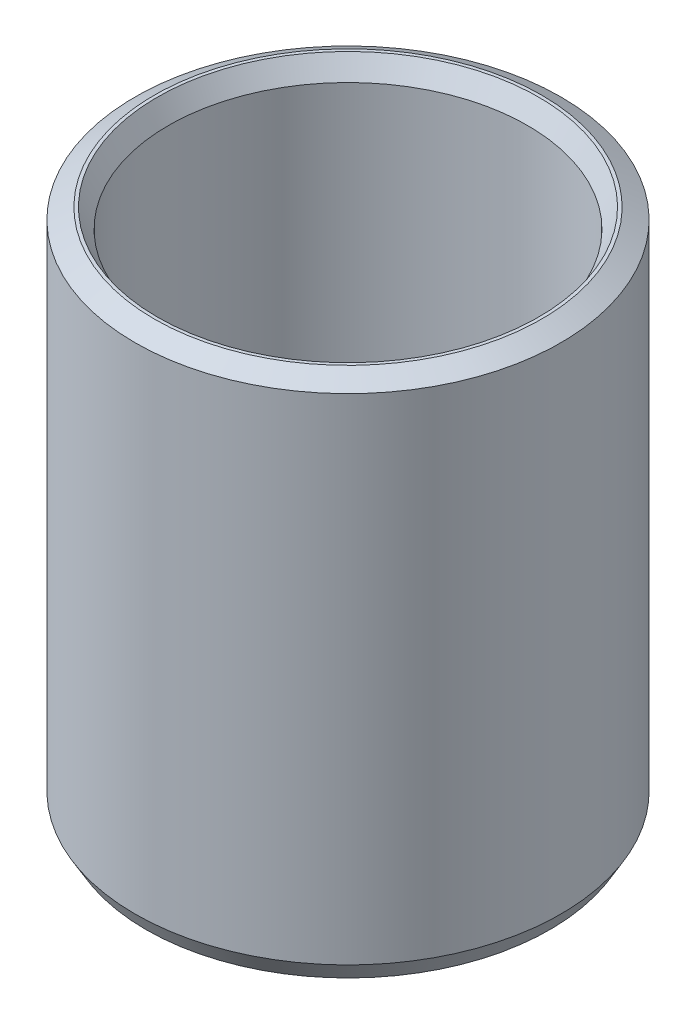
from build123d import *
from OCP.BRepFilletAPI import BRepFilletAPI_MakeChamfer

# Parameters (mm, degrees)
SKETCH1_R           = 37.5
BOSS_EXTRUDE1_DEPTH = 92.440721983
SKETCH2_R           = 31.630293139
CUT_EXTRUDE1_DEPTH  = 107.572919078
CHAMFER1_SIZE       = 1.940517333
CHAMFER1_SIZE2      = 3.361074614


with BuildPart() as part:
    # Sketch1 → Boss-Extrude1 (new body)
    with BuildSketch(Plane(origin=(0, 0, 0), x_dir=(1, 0, 0), z_dir=(0, 1, 0))):
        Circle(SKETCH1_R)
    extrude(amount=BOSS_EXTRUDE1_DEPTH)

    # Sketch2 → Cut-Extrude1 (cut, through all)
    with BuildSketch(Plane(origin=(0, 0, 0), x_dir=(1, 0, 0), z_dir=(0, 1, 0))):
        Circle(SKETCH2_R)
    extrude(amount=CUT_EXTRUDE1_DEPTH, mode=Mode.SUBTRACT)

    # Chamfer1: one chamfer whose edges measure the first distance from different faces: ONE call of the kernel's chamfer builder (chamfer() names one face for all edges)
    chamfer1_edges_1 = [part.edges().sort_by_distance(p)[0] for p in [
        (-31.630293139, 92.440721983, 0),
    ]]
    chamfer1_side_1 = [part.faces().sort_by_distance(p)[0] for p in [
        (-36.439339828, 92.440721983, 0),
    ]]
    chamfer1_edges_2 = [part.edges().sort_by_distance(p)[0] for p in [
        (-31.630293139, 0, 0),
    ]]
    chamfer1_side_2 = [part.faces().sort_by_distance(p)[0] for p in [
        (-31.630293139, 46.220360992, 0),
    ]]
    chamfer1_edges_3 = [part.edges().sort_by_distance(p)[0] for p in [
        (-37.5, 0, 0),
    ]]
    chamfer1_side_3 = [part.faces().sort_by_distance(p)[0] for p in [
        (-36.439339828, 0, 0),
    ]]
    chamfer1_edges_4 = [part.edges().sort_by_distance(p)[0] for p in [
        (-37.5, 92.440721983, 0),
    ]]
    chamfer1_side_4 = [part.faces().sort_by_distance(p)[0] for p in [
        (-37.5, 46.220360992, 0),
    ]]
    chamfer1 = BRepFilletAPI_MakeChamfer(part.part.solid().wrapped)
    for e in chamfer1_edges_1:
        chamfer1.Add(CHAMFER1_SIZE, CHAMFER1_SIZE2, e.wrapped, chamfer1_side_1[0].wrapped)  # the first distance lies on this face
    for e in chamfer1_edges_2:
        chamfer1.Add(CHAMFER1_SIZE, CHAMFER1_SIZE2, e.wrapped, chamfer1_side_2[0].wrapped)  # the first distance lies on this face
    for e in chamfer1_edges_3:
        chamfer1.Add(CHAMFER1_SIZE, CHAMFER1_SIZE2, e.wrapped, chamfer1_side_3[0].wrapped)  # the first distance lies on this face
    for e in chamfer1_edges_4:
        chamfer1.Add(CHAMFER1_SIZE, CHAMFER1_SIZE2, e.wrapped, chamfer1_side_4[0].wrapped)  # the first distance lies on this face
    add(Compound.cast(chamfer1.Shape()), mode=Mode.REPLACE)


solid = part.part
